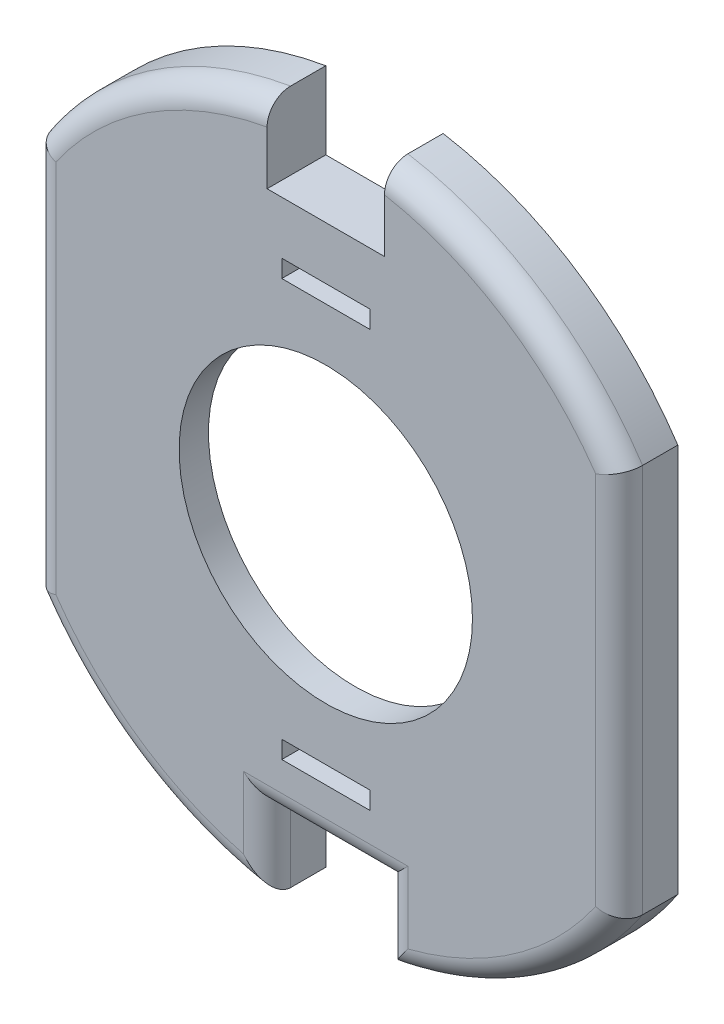
from build123d import *

# Parameters (mm, degrees)
BOSS_EXTRUDE1_DEPTH = 1
FILLET1_R           = 0.4
SHELL1_DEPTH        = 0.5
SKETCH3_R           = 2.5
CUT_EXTRUDE1_DEPTH  = 1
CUT_EXTRUDE2_REACH  = 9.81
SKETCH4_W           = 1.5
SKETCH4_H           = 0.3


# Read off the part's stored shape, not the designer's step: Shell1
with BuildPart() as part:
    # Sketch2 → Boss-Extrude1 (new body)
    with BuildSketch(Plane.XY):
        with BuildLine():
            Line((-5, -3.31662479), (-5, 3.31662479))
            ThreePointArc((-5, 3.31662479), (-3.269448205, 5.030974899), (-1, 5.916079783))
            Line((-1, 5.916079783), (-1, 4.6))
            Line((-1, 4.6), (1, 4.6))
            Line((1, 4.6), (1, 5.916079783))
            ThreePointArc((1, 5.916079783), (3.269448205, 5.030974899), (5, 3.31662479))
            Line((5, 3.31662479), (5, -3.31662479))
            ThreePointArc((5, -3.31662479), (3.269448205, -5.030974899), (1, -5.916079783))
            Line((1, -5.916079783), (1, -4.6))
            Line((1, -4.6), (-1, -4.6))
            Line((-1, -4.6), (-1, -5.916079783))
            ThreePointArc((-1, -5.916079783), (-3.269448205, -5.030974899), (-5, -3.31662479))
        make_face()
    extrude(amount=BOSS_EXTRUDE1_DEPTH)

    # Fillet1
    fillet1_edges = [part.edges().sort_by_distance(p)[0] for p in [
        (3.269448205, 5.030974899, 1),
        (5, 0, 1),
        (3.269448205, -5.030974899, 1),
        (1, -5.258039892, 1),
        (0, -4.6, 1),
        (-1, -5.258039892, 1),
        (-3.269448205, -5.030974899, 1),
        (-5, 0, 1),
        (-3.269448205, 5.030974899, 1),
    ]]
    fillet(fillet1_edges, radius=FILLET1_R)

    # Shell1 outline → Shell1 (cut)
    with BuildSketch(Plane.XY):
        with BuildLine():
            ThreePointArc((1.5, -5.291502622), (3.183300133, -4.485153316), (4.5, -3.16227766))
            Line((4.5, -3.16227766), (4.5, 3.16227766))
            ThreePointArc((4.5, 3.16227766), (3.183300133, 4.485153316), (1.5, 5.291502622))
            Line((1.5, 5.291502622), (1.5, 4.1))
            Line((1.5, 4.1), (-1.5, 4.1))
            Line((-1.5, 4.1), (-1.5, 5.291502622))
            ThreePointArc((-1.5, 5.291502622), (-3.183300133, 4.485153316), (-4.5, 3.16227766))
            Line((-4.5, 3.16227766), (-4.5, -3.16227766))
            ThreePointArc((-4.5, -3.16227766), (-3.183300133, -4.485153316), (-1.5, -5.291502622))
            Line((-1.5, -5.291502622), (-1.5, -4.1))
            Line((-1.5, -4.1), (1.5, -4.1))
            Line((1.5, -4.1), (1.5, -5.291502622))
        make_face()
    extrude(amount=SHELL1_DEPTH, mode=Mode.SUBTRACT)

    # Sketch3 → Cut-Extrude1 (cut)
    with BuildSketch(Plane.XY.offset(1)):
        Circle(SKETCH3_R)
    extrude(amount=-CUT_EXTRUDE1_DEPTH, mode=Mode.SUBTRACT)

    # Sketch4 → Cut-Extrude2 (cut, up to next)
    with BuildSketch(Plane.XY.offset(1), mode=Mode.PRIVATE) as cut_extrude2_sk1:
        with Locations((0, 3.55)):
            Rectangle(SKETCH4_W, SKETCH4_H)
    cut_extrude2_tool1 = extrude(cut_extrude2_sk1.sketch, amount=-CUT_EXTRUDE2_REACH, mode=Mode.PRIVATE) & part.part
    # Sketch4 → Cut-Extrude2 (cut, up to next)
    with BuildSketch(Plane.XY.offset(1), mode=Mode.PRIVATE) as cut_extrude2_sk2:
        with Locations((0, -3.55)):
            Rectangle(SKETCH4_W, SKETCH4_H)
    cut_extrude2_tool2 = extrude(cut_extrude2_sk2.sketch, amount=-CUT_EXTRUDE2_REACH, mode=Mode.PRIVATE) & part.part
    add(cut_extrude2_tool1.solids().sort_by_distance((0, 3.55, 1))[0], mode=Mode.SUBTRACT)
    add(cut_extrude2_tool2.solids().sort_by_distance((0, -3.55, 1))[0], mode=Mode.SUBTRACT)


solid = part.part
